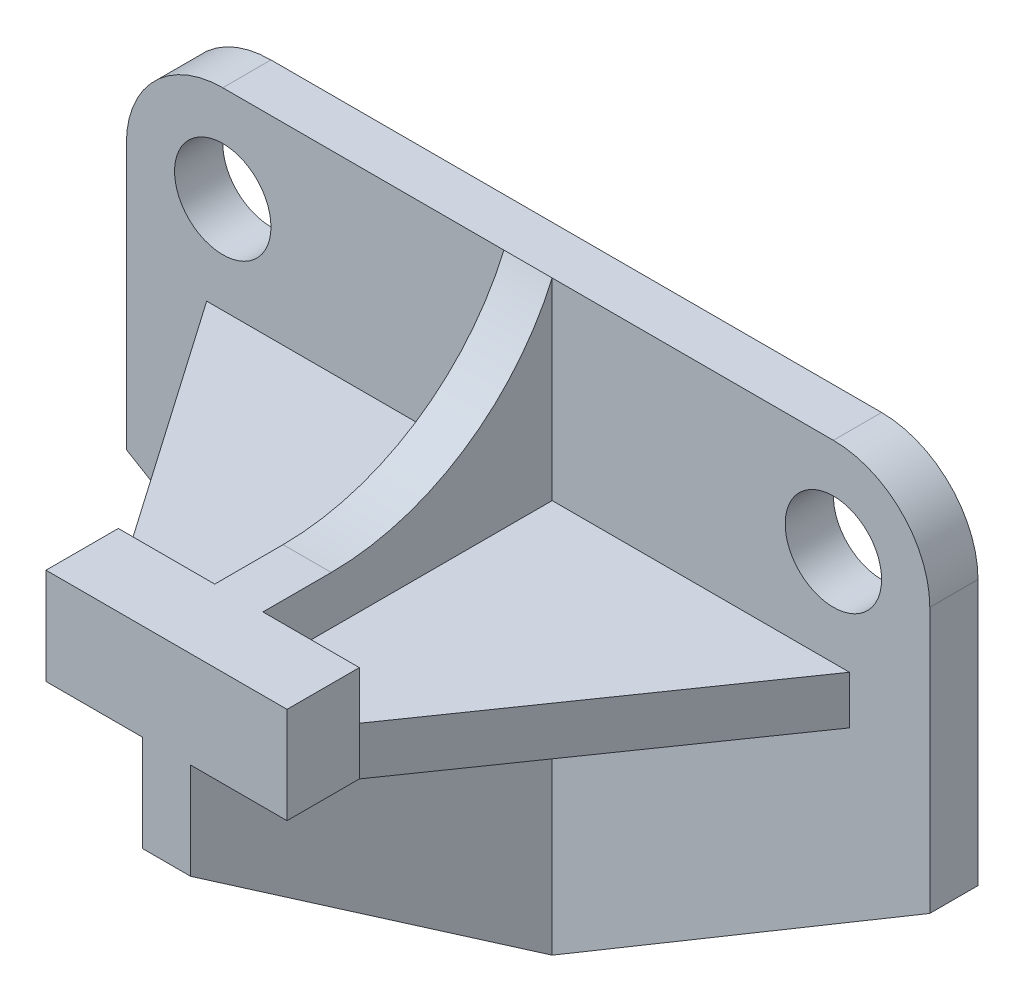
from build123d import *

# Parameters (mm, degrees)
BOSS_EXTRUDE1_DEPTH = 6
SKETCH3_W           = 30
SKETCH3_H           = 12
BOSS_EXTRUDE2_DEPTH = 9
BOSS_EXTRUDE3_DEPTH = 6
RIB1_START          = -3
RIB1_DEPTH          = 6
RIB2_START          = -3
RIB2_DEPTH          = 6
SKETCH9_R           = 6
CUT_EXTRUDE1_DEPTH  = 6
FILLET1_R           = 12


# Read off the part's stored shape, not the designer's step: Rib1, Rib2
with BuildPart() as part:
    # Sketch1 → Boss-Extrude1 (new body)
    with BuildSketch(Plane.XY):
        Polygon((-50, 36.5), (50, 36.5), (50, -8.5), (3, -36.5), (-3, -36.5), (-50, -8.5), align=None)
    extrude(amount=BOSS_EXTRUDE1_DEPTH)



with BuildPart() as body_2:
    # Sketch3 → Boss-Extrude2 (new body)
    with BuildSketch(Plane.XY.offset(51)):
        with Locations((0, 12.5)):
            Rectangle(SKETCH3_W, SKETCH3_H)
    extrude(amount=-BOSS_EXTRUDE2_DEPTH)


with BuildPart() as part_1:
    add(part.part)

    add(body_2.part)  # Boss-Extrude3 merges body 2
    # Sketch5 → Boss-Extrude3 (add)
    with BuildSketch(Plane(origin=(0, 6.5, 0), x_dir=(-1, 0, 0), z_dir=(0, -1, 0))):
        Polygon((15, -42), (40, -6), (-40, -6), (-15, -42), align=None)
    extrude(amount=-BOSS_EXTRUDE3_DEPTH)

    # Rib1 outline → Rib1 (add)
    with BuildSketch(Plane.ZY.offset(RIB1_START)):
        Polygon((6, -36.5), (51, -5.5), (51, 6.5), (6, 6.5), align=None)
    extrude(amount=RIB1_DEPTH)

    # Rib2 outline → Rib2 (add)
    with BuildSketch(Plane.ZY.offset(RIB2_START)):
        with BuildLine():
            Line((42, 12.5), (42, 18.5))
            Line((42, 18.5), (33.49545417, 18.5))
            ThreePointArc((33.49545417, 18.5), (17.063777445, 23.400199204), (6, 36.5))
            Line((6, 36.5), (6, 12.5))
            Line((6, 12.5), (42, 12.5))
        make_face()
    extrude(amount=RIB2_DEPTH)

    # Sketch9 → Cut-Extrude1 (cut)
    with BuildSketch(Plane.XY):
        with Locations((-38, 24.5)):
            Circle(SKETCH9_R)
        with Locations((38, 24.5)):
            Circle(SKETCH9_R)
    extrude(amount=CUT_EXTRUDE1_DEPTH, mode=Mode.SUBTRACT)

    # Fillet1
    fillet1_edges = [part_1.edges().sort_by_distance(p)[0] for p in [
        (-50, 36.5, 3),
        (50, 36.5, 3),
    ]]
    fillet(fillet1_edges, radius=FILLET1_R)


solid = part_1.part
